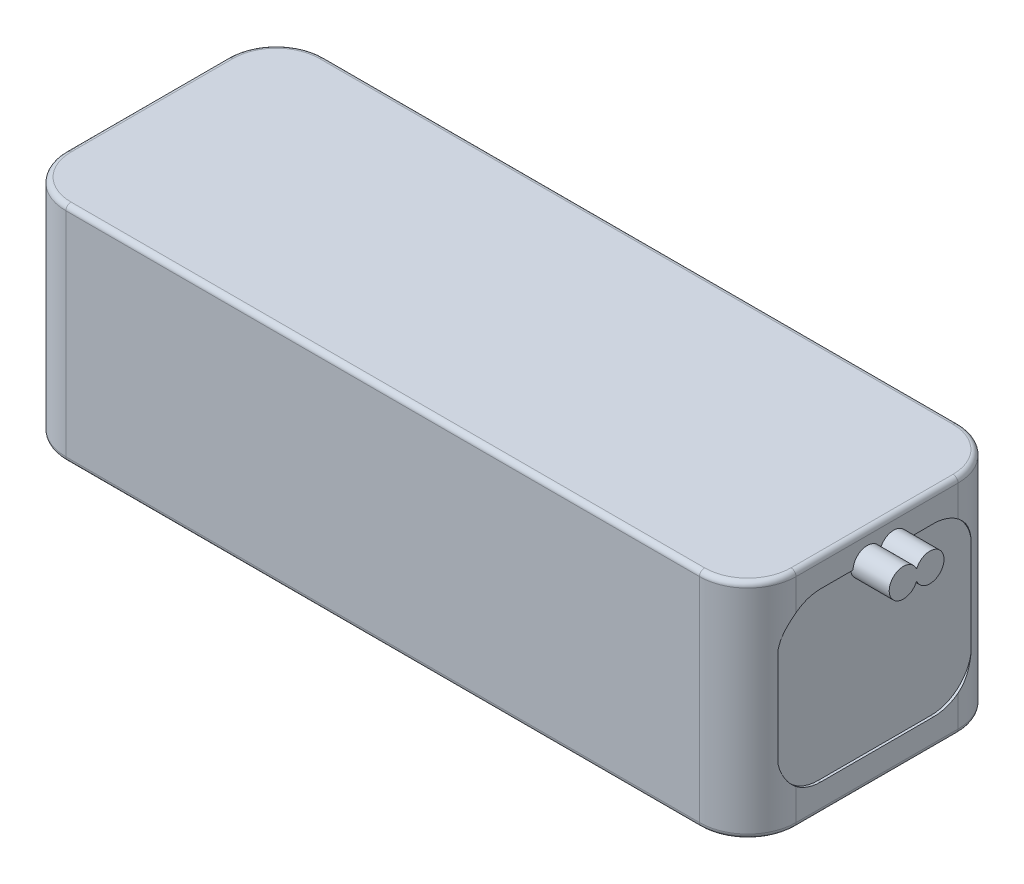
from build123d import *

# Parameters (mm, degrees)
SKETCH1_W                = 144
SKETCH1_H                = 44
BOSS_EXTRUDE1_DEPTH      = 51
CUT_EXTRUDE1_DEPTH       = 0.5
CUT_EXTRUDE2_DEPTH       = 0.5
FILLET1_R                = 9.525
FILLET2_R                = 1
BOSS_EXTRUDE2_DEPTH      = 7.62
BOSS_EXTRUDE2_DEPTH_BACK = 2.54


with BuildPart() as part:
    # Sketch1 → Boss-Extrude1 (new body)
    with BuildSketch(Plane(origin=(0, 0, -15), x_dir=(-1, 0, 0), z_dir=(0, 0, -1))):
        with Locations((3, 0)):
            Rectangle(SKETCH1_W, SKETCH1_H)
    extrude(amount=-BOSS_EXTRUDE1_DEPTH)

    # Sketch2 → Cut-Extrude1 (cut)
    with BuildSketch(Plane(origin=(69, 0, 0), x_dir=(0, 0, -1), z_dir=(1, 0, 0))):
        with BuildLine():
            Line((-29.625, 8.5), (-29.625, -8.5))
            ThreePointArc((-29.625, -8.5), (-27.281854249, -14.156854249), (-21.625, -16.5))
            Line((-21.625, -16.5), (0.625, -16.5))
            ThreePointArc((0.625, -16.5), (6.281854249, -14.156854249), (8.625, -8.5))
            Line((8.625, -8.5), (8.625, 8.5))
            ThreePointArc((8.625, 8.5), (6.281854249, 14.156854249), (0.625, 16.5))
            Line((0.625, 16.5), (-21.625, 16.5))
            ThreePointArc((-21.625, 16.5), (-27.281854249, 14.156854249), (-29.625, 8.5))
        make_face()
    extrude(amount=-CUT_EXTRUDE1_DEPTH, mode=Mode.SUBTRACT)

    # Sketch3 → Cut-Extrude2 (cut)
    with BuildSketch(Plane.ZY.offset(75)):
        with BuildLine():
            Line((18.195, 16.5), (2.805, 16.5))
            ThreePointArc((2.805, 16.5), (-5.277230509, 13.152230509), (-8.625, 5.07))
            Line((-8.625, 5.07), (-8.625, -5.07))
            ThreePointArc((-8.625, -5.07), (-5.277230509, -13.152230509), (2.805, -16.5))
            Line((2.805, -16.5), (18.195, -16.5))
            ThreePointArc((18.195, -16.5), (26.277230509, -13.152230509), (29.625, -5.07))
            Line((29.625, -5.07), (29.625, 5.07))
            ThreePointArc((29.625, 5.07), (26.277230509, 13.152230509), (18.195, 16.5))
        make_face()
    extrude(amount=-CUT_EXTRUDE2_DEPTH, mode=Mode.SUBTRACT)

    # Fillet1
    # the kernel refuses this fillet: 9.525 mm, written as the material it takes off along each edge
    with BuildSketch(Plane(origin=(-75, -45.8125, -15), x_dir=(0, 0, 1), z_dir=(0, 1, 0)), Plane(origin=(69, 45.8125, -15), x_dir=(0, 0, 1), z_dir=(0, -1, 0))) as fillet1_piece_1:
        with BuildLine():
            CenterArc((FILLET1_R, FILLET1_R), FILLET1_R, 180, 90)
            Line((0, FILLET1_R), (0, 0))
            Line((0, 0), (FILLET1_R, 0))
        make_face()
    extrude(amount=91.625, mode=Mode.SUBTRACT)
    with BuildSketch(Plane(origin=(-75, -45.8125, 36), x_dir=(0, 0, -1), z_dir=(0, 1, 0)), Plane(origin=(69, 45.8125, 36), x_dir=(0, 0, -1), z_dir=(0, -1, 0))) as fillet1_piece_2:
        with BuildLine():
            CenterArc((FILLET1_R, -FILLET1_R), FILLET1_R, 90, 90)
            Line((0, -FILLET1_R), (0, 0))
            Line((0, 0), (FILLET1_R, 0))
        make_face()
    extrude(amount=91.625, mode=Mode.SUBTRACT)

    # Fillet2
    fillet2_edges = [part.edges().sort_by_distance(p)[0] for p in [
        (-3, -22, -15),
        (-3, 22, -15),
        (-75, 22, 10.5),
        (-3, 22, 36),
        (69, 22, 10.5),
        (66.210192091, 22, 33.210192091),
        (66.210192091, 22, -12.210192091),
        (-72.210192091, 22, 33.210192091),
        (-72.210192091, 22, -12.210192091),
        (-75, -22, 10.5),
        (69, -22, 10.5),
        (-3, -22, 36),
        (66.210192091, -22, 33.210192091),
        (66.210192091, -22, -12.210192091),
        (-72.210192091, -22, 33.210192091),
        (-72.210192091, -22, -12.210192091),
    ]]
    fillet(fillet2_edges, radius=FILLET2_R)

    # Sketch5 → Boss-Extrude2 (add, two sides: drawn at the far end of the back side and taken through both)
    with BuildSketch(Plane(origin=(68.5, 0, 0), x_dir=(0, 0, -1), z_dir=(1, 0, 0)).offset(-BOSS_EXTRUDE2_DEPTH_BACK)):
        with BuildLine():
            Line((-10.019743612, 16.5), (-9.645122715, 16.5))
            ThreePointArc((-9.645122715, 16.5), (-9.692349462, 17.011539536), (-9.832433164, 17.505786052))
            ThreePointArc((-9.832433164, 17.505786052), (-9.972516865, 17.011539536), (-10.019743612, 16.5))
        make_face()
        with BuildLine():
            Line((-4.431743612, 16.5), (-9.645122715, 16.5))
            ThreePointArc((-9.645122715, 16.5), (-9.692349462, 15.988460464), (-9.832433164, 15.494213948))
            ThreePointArc((-9.832433164, 15.494213948), (-6.714204076, 13.753226747), (-4.431743612, 16.5))
        make_face()
        with BuildLine():
            ThreePointArc((-9.832433164, 17.505786052), (-9.692349462, 17.011539536), (-9.645122715, 16.5))
            Line((-9.645122715, 16.5), (-4.431743612, 16.5))
            ThreePointArc((-4.431743612, 16.5), (-6.714204076, 19.246773253), (-9.832433164, 17.505786052))
        make_face()
        with BuildLine():
            ThreePointArc((-9.832433164, 15.494213948), (-9.692349462, 15.988460464), (-9.645122715, 16.5))
            Line((-9.645122715, 16.5), (-10.019743612, 16.5))
            ThreePointArc((-10.019743612, 16.5), (-9.972516865, 15.988460464), (-9.832433164, 15.494213948))
        make_face()
        with BuildLine():
            ThreePointArc((-10.019743612, 16.5), (-9.972516865, 17.011539536), (-9.832433164, 17.505786052))
            ThreePointArc((-9.832433164, 17.505786052), (-12.950662251, 19.246773253), (-15.233122715, 16.5))
            Line((-15.233122715, 16.5), (-10.019743612, 16.5))
        make_face()
        with BuildLine():
            ThreePointArc((-15.233122715, 16.5), (-12.950662251, 13.753226747), (-9.832433164, 15.494213948))
            ThreePointArc((-9.832433164, 15.494213948), (-9.972516865, 15.988460464), (-10.019743612, 16.5))
            Line((-10.019743612, 16.5), (-15.233122715, 16.5))
        make_face()
    extrude(amount=BOSS_EXTRUDE2_DEPTH + BOSS_EXTRUDE2_DEPTH_BACK)


solid = part.part
